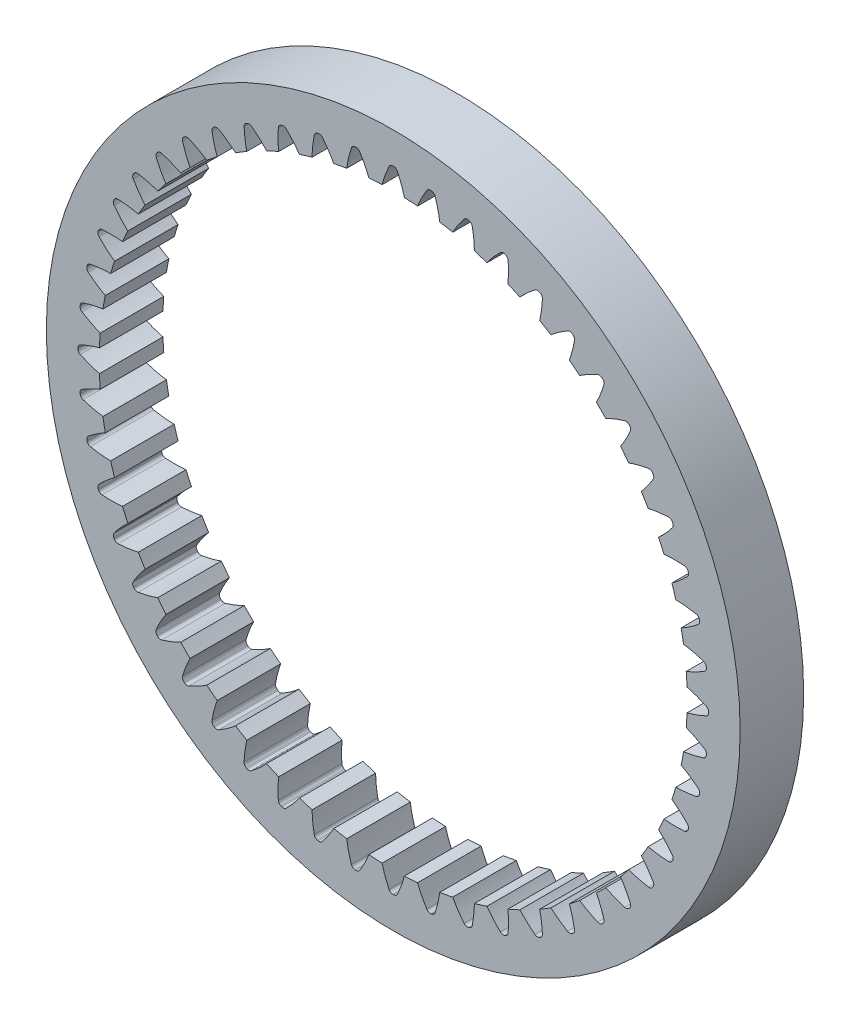
from build123d import *

# Parameters (mm, degrees)
SKETCH3_R           = 15.015
SKETCH3_R_2         = 12.725
BOSS_EXTRUDE2_DEPTH = 2.75
CUT_EXTRUDE2_DEPTH  = 22.411747944
CIRPATTERN1_COUNT   = 52


with BuildPart() as part:
    # Sketch3 → Boss-Extrude2 (new body)
    with BuildSketch(Plane.XY):
        Circle(SKETCH3_R)
        Circle(SKETCH3_R_2, mode=Mode.SUBTRACT)
    extrude(amount=BOSS_EXTRUDE2_DEPTH)

    # Sketch1 → Cut-Extrude2 (cut, through all)
    with BuildSketch(Plane.XY):
        with BuildLine():
            Line((12.715842886, 0.482664174), (12.715842886, -0.482664174))
            add(Edge.make_bspline(
                [(12.715842886, -0.482664174), (12.721803166, -0.481168563), (12.733538214, -0.478183782), (12.761000405, -0.471113835), (12.783660122, -0.464958545), (12.814566556, -0.45650787), (12.84043313, -0.449102916), (12.869251292, -0.44074033), (12.896184239, -0.432643593), (12.924178874, -0.424069151), (12.951413669, -0.415492271), (12.979054571, -0.406601136), (13.006291105, -0.397640788), (13.033780284, -0.388388809), (13.066078862, -0.37732125), (13.105675963, -0.363343904), (13.150866268, -0.347008462), (13.204331014, -0.326824677), (13.256501619, -0.30664778), (13.312504328, -0.283986598), (13.361750519, -0.26376529), (13.421399504, -0.238046577), (13.463262395, -0.219913533), (13.516263041, -0.195814358), (13.537643023, -0.186006691), (13.548793224, -0.180837387)],
                knots=[0.06236262, 0.06236262, 0.06236262, 0.06236262, 0.06236262, 0.090067024, 0.117771545, 0.145476147, 0.173180566, 0.200885104, 0.228589669, 0.256294118, 0.283998672, 0.311703205, 0.339407674, 0.367112233, 0.394816785, 0.422521219, 0.471487932, 0.526897007, 0.582305997, 0.63771503, 0.693124089, 0.748533108, 0.803942174, 0.859351157, 0.91476024, 0.91476024, 0.91476024, 0.91476024, 0.91476024], degree=4))
            ThreePointArc((13.548793224, -0.180837387), (13.622448151, -0.116514459), (13.649981154, -0.022682583))
            Line((13.649981154, -0.022682583), (13.649981154, 0.022682583))
            ThreePointArc((13.649981154, 0.022682583), (13.622448151, 0.116514459), (13.548793224, 0.180837387))
            add(Edge.make_bspline(
                [(12.715842886, 0.482664174), (12.721803166, 0.481168563), (12.733538214, 0.478183782), (12.761000405, 0.471113835), (12.783660122, 0.464958545), (12.814566556, 0.45650787), (12.84043313, 0.449102916), (12.869251292, 0.44074033), (12.896184239, 0.432643593), (12.924178874, 0.424069151), (12.951413669, 0.415492271), (12.979054571, 0.406601136), (13.006291105, 0.397640788), (13.033780284, 0.388388809), (13.066078862, 0.37732125), (13.105675963, 0.363343904), (13.150866268, 0.347008462), (13.204331014, 0.326824677), (13.256501619, 0.30664778), (13.312504328, 0.283986598), (13.361750519, 0.26376529), (13.421399504, 0.238046577), (13.463262395, 0.219913533), (13.516263041, 0.195814358), (13.537643023, 0.186006691), (13.548793224, 0.180837387)],
                knots=[0.06236262, 0.06236262, 0.06236262, 0.06236262, 0.06236262, 0.090067024, 0.117771545, 0.145476147, 0.173180566, 0.200885104, 0.228589669, 0.256294118, 0.283998672, 0.311703205, 0.339407674, 0.367112233, 0.394816785, 0.422521219, 0.471487932, 0.526897007, 0.582305997, 0.63771503, 0.693124089, 0.748533108, 0.803942174, 0.859351157, 0.91476024, 0.91476024, 0.91476024, 0.91476024, 0.91476024], degree=4))
        make_face()
    cut_extrude2 = extrude(amount=CUT_EXTRUDE2_DEPTH, mode=Mode.SUBTRACT)

    # CirPattern1: Cut-Extrude2 ×52 about axis
    cirpattern1_axis = Axis((0, 0, 2.8875), (0, 0, -1))
    for i in range(1, CIRPATTERN1_COUNT):
        add(cut_extrude2.rotate(cirpattern1_axis, i * 360 / CIRPATTERN1_COUNT), mode=Mode.SUBTRACT)


solid = part.part
